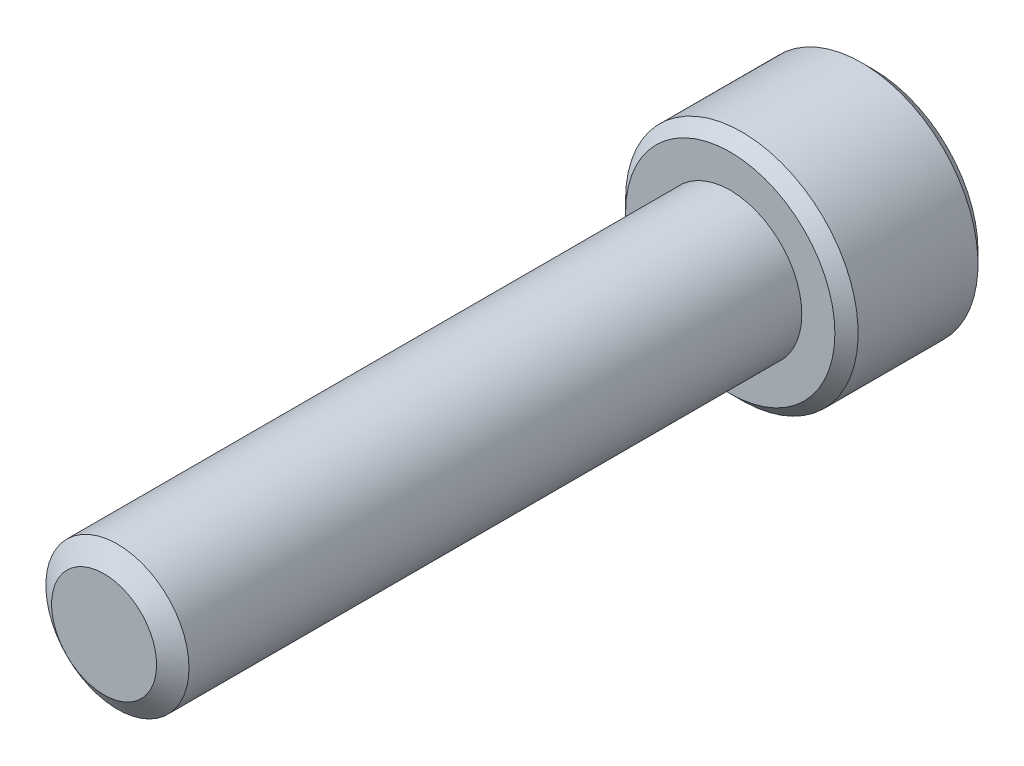
from build123d import *

# Parameters (mm, degrees)
SKETCH1_R          = 4
EXTRUDE1_DEPTH     = 35
SKETCH6_R          = 6.5
EXTRUDE2_DEPTH     = 8
CUT_EXTRUDE1_DEPTH = 4.5
CHAMFER1_SIZE      = 0.65


with BuildPart() as part:
    # Sketch1 → Extrude1 (new body)
    with BuildSketch(Plane.XY):
        Circle(SKETCH1_R)
    extrude(amount=-EXTRUDE1_DEPTH)

    # Sketch4 → Cut-Revolve1 (revolve, cut)
    with BuildSketch(Plane(origin=(0, 0, 0), x_dir=(0, 0, -1), z_dir=(1, 0, 0))):
        Polygon((0.746350386, 4), (0, 2.934101184), (0, 4), align=None)
    revolve(axis=Axis((0, 0, 0), (0, 0, -1)), mode=Mode.SUBTRACT)

    # Sketch6 → Extrude2 (add)
    with BuildSketch(Plane(origin=(0, 0, -35), x_dir=(-1, 0, 0), z_dir=(0, 0, -1))):
        Circle(SKETCH6_R)
    extrude(amount=EXTRUDE2_DEPTH)

    # Sketch7 → Cut-Extrude1 (cut)
    with BuildSketch(Plane(origin=(0, 0, -43), x_dir=(-1, 0, 0), z_dir=(0, 0, -1))):
        Polygon((0, 3.464101615), (-3, 1.732050808), (-3, -1.732050808), (0, -3.464101615), (3, -1.732050808), (3, 1.732050808), align=None)
    extrude(amount=-CUT_EXTRUDE1_DEPTH, mode=Mode.SUBTRACT)

    # Cut-Extrude2 cone 1 section (through the dimple's axis) → Cut-Extrude2 (revolve, cut)
    with BuildSketch(Plane(origin=(0, 0, -43), x_dir=(0, 1, 0), z_dir=(1, 0, 0))):
        Polygon((0, 0), (3.464101615, 0), (0, 3.464101615), align=None)
    revolve(axis=Axis((0, 0, -43), (0, 0, 1)), mode=Mode.SUBTRACT)

    # Chamfer1
    chamfer1_edges = [part.edges().sort_by_distance(p)[0] for p in [
        (6.5, 0, -43),
        (6.5, 0, -35),
    ]]
    chamfer(chamfer1_edges, length=CHAMFER1_SIZE)


solid = part.part
